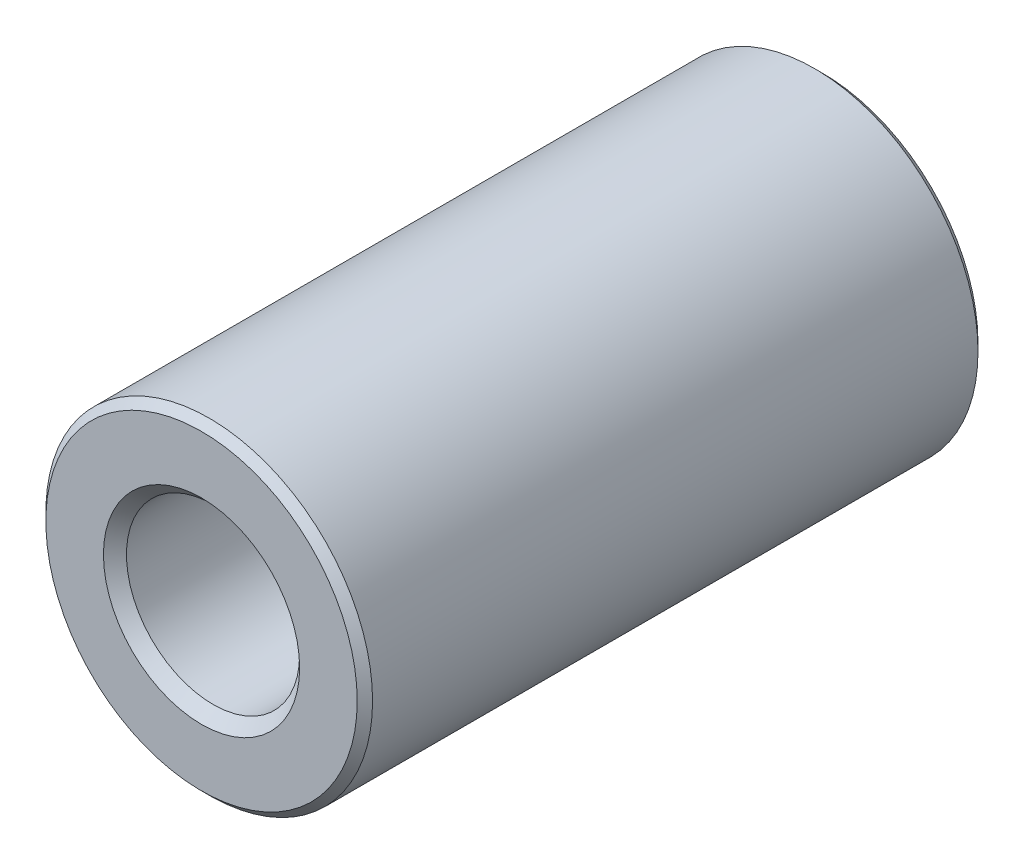
from build123d import *

# Parameters (mm, degrees)
BOSS_EXTRUDE1_DEPTH      = 9.5
BOSS_EXTRUDE1_DEPTH_BACK = 9.5
SKETCH3_R                = 5
SKETCH3_R_2              = 2.65
CHAMFER1_SIZE            = 0.235
CHAMFER2_SIZE            = 0.3525


with BuildPart() as part:
    # Sketch3 → Boss-Extrude1 (new, two sides: drawn at the far end of the back side and taken through both)
    with BuildSketch(Plane.XY.offset(-BOSS_EXTRUDE1_DEPTH_BACK)):
        Circle(SKETCH3_R)
        Circle(SKETCH3_R_2, mode=Mode.SUBTRACT)
    extrude(amount=BOSS_EXTRUDE1_DEPTH + BOSS_EXTRUDE1_DEPTH_BACK)

    # Chamfer1
    chamfer1_edges = [part.edges().sort_by_distance(p)[0] for p in [
        (-5, 0, -9.5),
        (-5, 0, 9.5),
    ]]
    chamfer(chamfer1_edges, length=CHAMFER1_SIZE)

    # Chamfer2
    chamfer2_edges = [part.edges().sort_by_distance(p)[0] for p in [
        (-2.65, 0, -9.5),
        (-2.65, 0, 9.5),
    ]]
    chamfer(chamfer2_edges, length=CHAMFER2_SIZE)


solid = part.part
